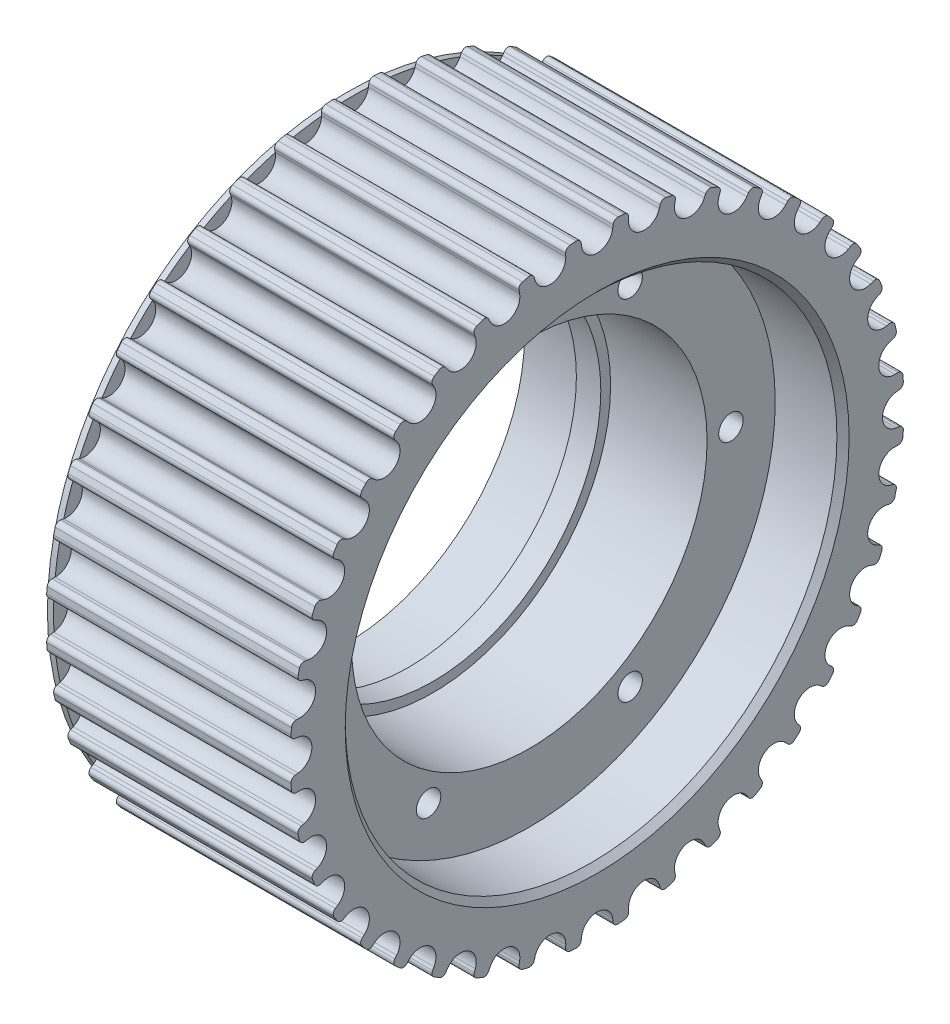
from build123d import *

# Parameters (mm, degrees)
CHAMFER_1_SIZE           = 1
SKETCH_4_W               = 6
SKETCH_4_H               = 2.799999952
CUT_EXTRUDE_1_DEPTH      = 77.373549557
CUT_EXTRUDE_2_REACH      = 78.374
PATTERN_CIRCULAR_3_COUNT = 40
EXTRUDE_1_DEPTH          = 12
SKETCH_8_R               = 24.1
CUT_EXTRUDE_3_DEPTH      = 12
SKETCH_9_R               = 29.1
CUT_EXTRUDE_4_DEPTH      = 82.398102377
SKETCH_10_R              = 40.25
CUT_EXTRUDE_5_DEPTH      = 11.1
SKETCH_11_R              = 2
CUT_EXTRUDE_6_DEPTH      = 77.556260819
CHAMFER_2_SIZE           = 1
SKETCH_12_R              = 49
SKETCH_12_R_2            = 29.1
SKETCH_12_R_3            = 2
EXTRUDE_2_DEPTH          = 1
SKETCH_13_R              = 3.7
CUT_EXTRUDE_7_DEPTH      = 5
EXTRUDE_START            = -4
SKETCH_14_R              = 29.1
SKETCH_14_R_2            = 27.5
EXTRUDE_3_DEPTH          = 4


with BuildPart() as part:
    # 草图1 → 旋转1 (revolve)
    with BuildSketch(Plane.XY):
        Polygon((0, 10.0488), (0, 50.244), (28, 50.244), (28, 20.0976), (20, 20.0976), (20, 10.0488), align=None)
    revolve(axis=Axis((0, 0, 0), (1, 0, 0)))

    # 倒角1
    chamfer_1_edges = [part.edges().sort_by_distance(p)[0] for p in [
        (20, -10.0488, 0),
        (0, -10.0488, 0),
    ]]
    chamfer(chamfer_1_edges, length=CHAMFER_1_SIZE)

    # 草图4 → 切除-拉伸1 (cut, through all)
    with BuildSketch(Plane.ZY):
        with Locations((0, 10.990536011)):
            Rectangle(SKETCH_4_W, SKETCH_4_H)
    extrude(amount=-CUT_EXTRUDE_1_DEPTH, mode=Mode.SUBTRACT)

    # 草图6 → 切除-拉伸2 (cut, up to next)
    with BuildSketch(Plane(origin=(0, 0, 0), x_dir=(0, 0, -1), z_dir=(1, 0, 0)), mode=Mode.PRIVATE) as cut_extrude_2_sk1:
        with BuildLine():
            Line((2.610069182, 49.443149367), (2.55084361, 48.960795787))
            ThreePointArc((2.55084361, 48.960795787), (0, 46.704), (-2.55084361, 48.960795787))
            Line((-2.55084361, 48.960795787), (-2.610069182, 49.443149367))
            ThreePointArc((-2.610069182, 49.443149367), (-2.88771069, 49.949625624), (-3.43762165, 50.126263509))
            ThreePointArc((-3.43762165, 50.126263509), (-3.826604204, 50.098070185), (-4.2153562, 50.066858381))
            Line((-4.2153562, 50.066858381), (-4.412004189, 51.668427723))
            ThreePointArc((-4.412004189, 51.668427723), (0, 51.856457691), (4.412004189, 51.668427723))
            Line((4.412004189, 51.668427723), (4.2153562, 50.066858381))
            ThreePointArc((4.2153562, 50.066858381), (3.826604204, 50.098070185), (3.43762165, 50.126263509))
            ThreePointArc((3.43762165, 50.126263509), (2.88771069, 49.949625624), (2.610069182, 49.443149367))
        make_face()
    cut_extrude_2_tool1 = extrude(cut_extrude_2_sk1.sketch, amount=CUT_EXTRUDE_2_REACH, mode=Mode.PRIVATE) & part.part
    cut_extrude_2 = cut_extrude_2_tool1.solids().sort_by_distance((0, 49.788918, 0))[0]
    add(cut_extrude_2, mode=Mode.SUBTRACT)

    # 阵列(圆周)3: 切除-拉伸2 ×40 about axis
    pattern_circular_3_axis = Axis((-1.4, 0, 0), (1, 0, 0))
    for i in range(1, PATTERN_CIRCULAR_3_COUNT):
        add(cut_extrude_2.rotate(pattern_circular_3_axis, i * 360 / PATTERN_CIRCULAR_3_COUNT), mode=Mode.SUBTRACT)

    # 草图7 → 凸台-拉伸1 (add)
    with BuildSketch(Plane.ZY):
        with BuildLine():
            Line((-5.156677722, 49.242726928), (-5.139717405, 48.757047001))
            ThreePointArc((-5.139717405, 48.757047001), (-7.306115255, 46.128996259), (-10.178594389, 47.95896729))
            Line((-10.178594389, 47.95896729), (-10.31254752, 48.426117376))
            ThreePointArc((-10.31254752, 48.426117376), (-10.666001143, 48.882925369), (-11.236774039, 48.971363522))
            ThreePointArc((-11.236774039, 48.971363522), (-11.729228862, 48.85575428), (-12.220494818, 48.735193058))
            ThreePointArc((-12.220494818, 48.735193058), (-12.688907112, 48.397268615), (-12.796450106, 47.829785125))
            Line((-12.796450106, 47.829785125), (-12.703721519, 47.352737902))
            ThreePointArc((-12.703721519, 47.352737902), (-14.432329705, 44.418143537), (-17.555714394, 45.776229851))
            Line((-17.555714394, 45.776229851), (-17.761096713, 46.216673658))
            ThreePointArc((-17.761096713, 46.216673658), (-18.181659249, 46.612565259), (-18.759239759, 46.610626038))
            ThreePointArc((-18.759239759, 46.610626038), (-19.227546376, 46.419403231), (-19.693904103, 46.223475391))
            ThreePointArc((-19.693904103, 46.223475391), (-20.103686434, 45.816435531), (-20.12113142, 45.239115275))
            Line((-20.12113142, 45.239115275), (-19.954917849, 44.782447241))
            ThreePointArc((-19.954917849, 44.782447241), (-21.2031723, 41.613568706), (-24.500554446, 42.466329711))
            Line((-24.500554446, 42.466329711), (-24.77230876, 42.86922205))
            ThreePointArc((-24.77230876, 42.86922205), (-25.249624564, 43.194449093), (-25.819790738, 43.102180249))
            ThreePointArc((-25.819790738, 43.102180249), (-26.252417886, 42.840052418), (-26.682384108, 42.573582352))
            ThreePointArc((-26.682384108, 42.573582352), (-27.023446277, 42.107449749), (-26.9503637, 41.534508266))
            Line((-26.9503637, 41.534508266), (-26.714757874, 41.109464105))
            ThreePointArc((-26.714757874, 41.109464105), (-27.451922423, 37.784329705), (-30.842109535, 38.110767595))
            Line((-30.842109535, 38.110767595), (-31.17354435, 38.46618792))
            ThreePointArc((-31.17354435, 38.46618792), (-31.695860322, 38.712742236), (-32.244572778, 38.532415735))
            ThreePointArc((-32.244572778, 38.532415735), (-32.63086774, 38.205837336), (-33.013855263, 37.875386423))
            ThreePointArc((-33.013855263, 37.875386423), (-33.277799186, 37.361638808), (-33.115988582, 36.807183819))
            Line((-33.115988582, 36.807183819), (-32.816791899, 36.424229528))
            ThreePointArc((-32.816791899, 36.424229528), (-33.024715109, 33.024715109), (-36.424229528, 32.816791899))
            Line((-36.424229528, 32.816791899), (-36.807183819, 33.115988582))
            ThreePointArc((-36.807183819, 33.115988582), (-37.361638808, 33.277799186), (-37.875386423, 33.013855263))
            ThreePointArc((-37.875386423, 33.013855263), (-38.205837336, 32.63086774), (-38.532415735, 32.244572778))
            ThreePointArc((-38.532415735, 32.244572778), (-38.712742236, 31.695860322), (-38.46618792, 31.17354435))
            Line((-38.46618792, 31.17354435), (-38.110767595, 30.842109535))
            ThreePointArc((-38.110767595, 30.842109535), (-37.784329705, 27.451922423), (-41.109464105, 26.714757874))
            Line((-41.109464105, 26.714757874), (-41.534508266, 26.9503637))
            ThreePointArc((-41.534508266, 26.9503637), (-42.107449749, 27.023446277), (-42.573582352, 26.682384108))
            ThreePointArc((-42.573582352, 26.682384108), (-42.840052418, 26.252417886), (-43.102180249, 25.819790738))
            ThreePointArc((-43.102180249, 25.819790738), (-43.194449093, 25.249624564), (-42.86922205, 24.77230876))
            Line((-42.86922205, 24.77230876), (-42.466329711, 24.500554446))
            ThreePointArc((-42.466329711, 24.500554446), (-41.613568706, 21.2031723), (-44.782447241, 19.954917849))
            Line((-44.782447241, 19.954917849), (-45.239115275, 20.12113142))
            ThreePointArc((-45.239115275, 20.12113142), (-45.816435531, 20.103686434), (-46.223475391, 19.693904103))
            ThreePointArc((-46.223475391, 19.693904103), (-46.419403231, 19.227546376), (-46.610626038, 18.759239759))
            ThreePointArc((-46.610626038, 18.759239759), (-46.612565259, 18.181659249), (-46.216673658, 17.761096713))
            Line((-46.216673658, 17.761096713), (-45.776229851, 17.555714394))
            ThreePointArc((-45.776229851, 17.555714394), (-44.418143537, 14.432329705), (-47.352737902, 12.703721519))
            Line((-47.352737902, 12.703721519), (-47.829785125, 12.796450106))
            ThreePointArc((-47.829785125, 12.796450106), (-48.397268615, 12.688907112), (-48.735193058, 12.220494818))
            ThreePointArc((-48.735193058, 12.220494818), (-48.85575428, 11.729228862), (-48.971363522, 11.236774039))
            ThreePointArc((-48.971363522, 11.236774039), (-48.882925369, 10.666001143), (-48.426117376, 10.31254752))
            Line((-48.426117376, 10.31254752), (-47.95896729, 10.178594389))
            ThreePointArc((-47.95896729, 10.178594389), (-46.128996259, 7.306115255), (-48.757047001, 5.139717405))
            Line((-48.757047001, 5.139717405), (-49.242726928, 5.156677722))
            ThreePointArc((-49.242726928, 5.156677722), (-49.786400323, 4.961684784), (-50.046888529, 4.446176394))
            ThreePointArc((-50.046888529, 4.446176394), (-50.089114516, 3.942098806), (-50.126263509, 3.43762165))
            ThreePointArc((-50.126263509, 3.43762165), (-49.949625624, 2.88771069), (-49.443149367, 2.610069182))
            Line((-49.443149367, 2.610069182), (-48.960795787, 2.55084361))
            ThreePointArc((-48.960795787, 2.55084361), (-46.704, 0), (-48.960795787, -2.55084361))
            Line((-48.960795787, -2.55084361), (-49.443149367, -2.610069182))
            ThreePointArc((-49.443149367, -2.610069182), (-49.949625624, -2.88771069), (-50.126263509, -3.43762165))
            ThreePointArc((-50.126263509, -3.43762165), (-50.089114516, -3.942098806), (-50.046888529, -4.446176394))
            ThreePointArc((-50.046888529, -4.446176394), (-49.786400323, -4.961684784), (-49.242726928, -5.156677722))
            Line((-49.242726928, -5.156677722), (-48.757047001, -5.139717405))
            ThreePointArc((-48.757047001, -5.139717405), (-46.128996259, -7.306115255), (-47.95896729, -10.178594389))
            Line((-47.95896729, -10.178594389), (-48.426117376, -10.31254752))
            ThreePointArc((-48.426117376, -10.31254752), (-48.882925369, -10.666001143), (-48.971363522, -11.236774039))
            ThreePointArc((-48.971363522, -11.236774039), (-48.85575428, -11.729228862), (-48.735193058, -12.220494818))
            ThreePointArc((-48.735193058, -12.220494818), (-48.397268615, -12.688907112), (-47.829785125, -12.796450106))
            Line((-47.829785125, -12.796450106), (-47.352737902, -12.703721519))
            ThreePointArc((-47.352737902, -12.703721519), (-44.418143537, -14.432329705), (-45.776229851, -17.555714394))
            Line((-45.776229851, -17.555714394), (-46.216673658, -17.761096713))
            ThreePointArc((-46.216673658, -17.761096713), (-46.612565259, -18.181659249), (-46.610626038, -18.759239759))
            ThreePointArc((-46.610626038, -18.759239759), (-46.419403231, -19.227546376), (-46.223475391, -19.693904103))
            ThreePointArc((-46.223475391, -19.693904103), (-45.816435531, -20.103686434), (-45.239115275, -20.12113142))
            Line((-45.239115275, -20.12113142), (-44.782447241, -19.954917849))
            ThreePointArc((-44.782447241, -19.954917849), (-41.613568706, -21.2031723), (-42.466329711, -24.500554446))
            Line((-42.466329711, -24.500554446), (-42.86922205, -24.77230876))
            ThreePointArc((-42.86922205, -24.77230876), (-43.194449093, -25.249624564), (-43.102180249, -25.819790738))
            ThreePointArc((-43.102180249, -25.819790738), (-42.840052418, -26.252417886), (-42.573582352, -26.682384108))
            ThreePointArc((-42.573582352, -26.682384108), (-42.107449749, -27.023446277), (-41.534508266, -26.9503637))
            Line((-41.534508266, -26.9503637), (-41.109464105, -26.714757874))
            ThreePointArc((-41.109464105, -26.714757874), (-37.784329705, -27.451922423), (-38.110767595, -30.842109535))
            Line((-38.110767595, -30.842109535), (-38.46618792, -31.17354435))
            ThreePointArc((-38.46618792, -31.17354435), (-38.712742236, -31.695860322), (-38.532415735, -32.244572778))
            ThreePointArc((-38.532415735, -32.244572778), (-38.205837336, -32.63086774), (-37.875386423, -33.013855263))
            ThreePointArc((-37.875386423, -33.013855263), (-37.361638808, -33.277799186), (-36.807183819, -33.115988582))
            Line((-36.807183819, -33.115988582), (-36.424229528, -32.816791899))
            ThreePointArc((-36.424229528, -32.816791899), (-33.024715109, -33.024715109), (-32.816791899, -36.424229528))
            Line((-32.816791899, -36.424229528), (-33.115988582, -36.807183819))
            ThreePointArc((-33.115988582, -36.807183819), (-33.277799186, -37.361638808), (-33.013855263, -37.875386423))
            ThreePointArc((-33.013855263, -37.875386423), (-32.63086774, -38.205837336), (-32.244572778, -38.532415735))
            ThreePointArc((-32.244572778, -38.532415735), (-31.695860322, -38.712742236), (-31.17354435, -38.46618792))
            Line((-31.17354435, -38.46618792), (-30.842109535, -38.110767595))
            ThreePointArc((-30.842109535, -38.110767595), (-27.451922423, -37.784329705), (-26.714757874, -41.109464105))
            Line((-26.714757874, -41.109464105), (-26.9503637, -41.534508266))
            ThreePointArc((-26.9503637, -41.534508266), (-27.023446277, -42.107449749), (-26.682384108, -42.573582352))
            ThreePointArc((-26.682384108, -42.573582352), (-26.252417886, -42.840052418), (-25.819790738, -43.102180249))
            ThreePointArc((-25.819790738, -43.102180249), (-25.249624564, -43.194449093), (-24.77230876, -42.86922205))
            Line((-24.77230876, -42.86922205), (-24.500554446, -42.466329711))
            ThreePointArc((-24.500554446, -42.466329711), (-21.2031723, -41.613568706), (-19.954917849, -44.782447241))
            Line((-19.954917849, -44.782447241), (-20.12113142, -45.239115275))
            ThreePointArc((-20.12113142, -45.239115275), (-20.103686434, -45.816435531), (-19.693904103, -46.223475391))
            ThreePointArc((-19.693904103, -46.223475391), (-19.227546376, -46.419403231), (-18.759239759, -46.610626038))
            ThreePointArc((-18.759239759, -46.610626038), (-18.181659249, -46.612565259), (-17.761096713, -46.216673658))
            Line((-17.761096713, -46.216673658), (-17.555714394, -45.776229851))
            ThreePointArc((-17.555714394, -45.776229851), (-14.432329705, -44.418143537), (-12.703721519, -47.352737902))
            Line((-12.703721519, -47.352737902), (-12.796450106, -47.829785125))
            ThreePointArc((-12.796450106, -47.829785125), (-12.688907112, -48.397268615), (-12.220494818, -48.735193058))
            ThreePointArc((-12.220494818, -48.735193058), (-11.729228862, -48.85575428), (-11.236774039, -48.971363522))
            ThreePointArc((-11.236774039, -48.971363522), (-10.666001143, -48.882925369), (-10.31254752, -48.426117376))
            Line((-10.31254752, -48.426117376), (-10.178594389, -47.95896729))
            ThreePointArc((-10.178594389, -47.95896729), (-7.306115255, -46.128996259), (-5.139717405, -48.757047001))
            Line((-5.139717405, -48.757047001), (-5.156677722, -49.242726928))
            ThreePointArc((-5.156677722, -49.242726928), (-4.961684784, -49.786400323), (-4.446176394, -50.046888529))
            ThreePointArc((-4.446176394, -50.046888529), (-3.942098806, -50.089114516), (-3.43762165, -50.126263509))
            ThreePointArc((-3.43762165, -50.126263509), (-2.88771069, -49.949625624), (-2.610069182, -49.443149367))
            Line((-2.610069182, -49.443149367), (-2.55084361, -48.960795787))
            ThreePointArc((-2.55084361, -48.960795787), (0, -46.704), (2.55084361, -48.960795787))
            Line((2.55084361, -48.960795787), (2.610069182, -49.443149367))
            ThreePointArc((2.610069182, -49.443149367), (2.88771069, -49.949625624), (3.43762165, -50.126263509))
            ThreePointArc((3.43762165, -50.126263509), (3.942098806, -50.089114516), (4.446176394, -50.046888529))
            ThreePointArc((4.446176394, -50.046888529), (4.961684784, -49.786400323), (5.156677722, -49.242726928))
            Line((5.156677722, -49.242726928), (5.139717405, -48.757047001))
            ThreePointArc((5.139717405, -48.757047001), (7.306115255, -46.128996259), (10.178594389, -47.95896729))
            Line((10.178594389, -47.95896729), (10.31254752, -48.426117376))
            ThreePointArc((10.31254752, -48.426117376), (10.666001143, -48.882925369), (11.236774039, -48.971363522))
            ThreePointArc((11.236774039, -48.971363522), (11.729228862, -48.85575428), (12.220494818, -48.735193058))
            ThreePointArc((12.220494818, -48.735193058), (12.688907112, -48.397268615), (12.796450106, -47.829785125))
            Line((12.796450106, -47.829785125), (12.703721519, -47.352737902))
            ThreePointArc((12.703721519, -47.352737902), (14.432329705, -44.418143537), (17.555714394, -45.776229851))
            Line((17.555714394, -45.776229851), (17.761096713, -46.216673658))
            ThreePointArc((17.761096713, -46.216673658), (18.181659249, -46.612565259), (18.759239759, -46.610626038))
            ThreePointArc((18.759239759, -46.610626038), (19.227546376, -46.419403231), (19.693904103, -46.223475391))
            ThreePointArc((19.693904103, -46.223475391), (20.103686434, -45.816435531), (20.12113142, -45.239115275))
            Line((20.12113142, -45.239115275), (19.954917849, -44.782447241))
            ThreePointArc((19.954917849, -44.782447241), (21.2031723, -41.613568706), (24.500554446, -42.466329711))
            Line((24.500554446, -42.466329711), (24.77230876, -42.86922205))
            ThreePointArc((24.77230876, -42.86922205), (25.249624564, -43.194449093), (25.819790738, -43.102180249))
            ThreePointArc((25.819790738, -43.102180249), (26.252417886, -42.840052418), (26.682384108, -42.573582352))
            ThreePointArc((26.682384108, -42.573582352), (27.023446277, -42.107449749), (26.9503637, -41.534508266))
            Line((26.9503637, -41.534508266), (26.714757874, -41.109464105))
            ThreePointArc((26.714757874, -41.109464105), (27.451922423, -37.784329705), (30.842109535, -38.110767595))
            Line((30.842109535, -38.110767595), (31.17354435, -38.46618792))
            ThreePointArc((31.17354435, -38.46618792), (31.695860322, -38.712742236), (32.244572778, -38.532415735))
            ThreePointArc((32.244572778, -38.532415735), (32.63086774, -38.205837336), (33.013855263, -37.875386423))
            ThreePointArc((33.013855263, -37.875386423), (33.277799186, -37.361638808), (33.115988582, -36.807183819))
            Line((33.115988582, -36.807183819), (32.816791899, -36.424229528))
            ThreePointArc((32.816791899, -36.424229528), (33.024715109, -33.024715109), (36.424229528, -32.816791899))
            Line((36.424229528, -32.816791899), (36.807183819, -33.115988582))
            ThreePointArc((36.807183819, -33.115988582), (37.361638808, -33.277799186), (37.875386423, -33.013855263))
            ThreePointArc((37.875386423, -33.013855263), (38.205837336, -32.63086774), (38.532415735, -32.244572778))
            ThreePointArc((38.532415735, -32.244572778), (38.712742236, -31.695860322), (38.46618792, -31.17354435))
            Line((38.46618792, -31.17354435), (38.110767595, -30.842109535))
            ThreePointArc((38.110767595, -30.842109535), (37.784329705, -27.451922423), (41.109464105, -26.714757874))
            Line((41.109464105, -26.714757874), (41.534508266, -26.9503637))
            ThreePointArc((41.534508266, -26.9503637), (42.107449749, -27.023446277), (42.573582352, -26.682384108))
            ThreePointArc((42.573582352, -26.682384108), (42.840052418, -26.252417886), (43.102180249, -25.819790738))
            ThreePointArc((43.102180249, -25.819790738), (43.194449093, -25.249624564), (42.86922205, -24.77230876))
            Line((42.86922205, -24.77230876), (42.466329711, -24.500554446))
            ThreePointArc((42.466329711, -24.500554446), (41.613568706, -21.2031723), (44.782447241, -19.954917849))
            Line((44.782447241, -19.954917849), (45.239115275, -20.12113142))
            ThreePointArc((45.239115275, -20.12113142), (45.816435531, -20.103686434), (46.223475391, -19.693904103))
            ThreePointArc((46.223475391, -19.693904103), (46.419403231, -19.227546376), (46.610626038, -18.759239759))
            ThreePointArc((46.610626038, -18.759239759), (46.612565259, -18.181659249), (46.216673658, -17.761096713))
            Line((46.216673658, -17.761096713), (45.776229851, -17.555714394))
            ThreePointArc((45.776229851, -17.555714394), (44.418143537, -14.432329705), (47.352737902, -12.703721519))
            Line((47.352737902, -12.703721519), (47.829785125, -12.796450106))
            ThreePointArc((47.829785125, -12.796450106), (48.397268615, -12.688907112), (48.735193058, -12.220494818))
            ThreePointArc((48.735193058, -12.220494818), (48.85575428, -11.729228862), (48.971363522, -11.236774039))
            ThreePointArc((48.971363522, -11.236774039), (48.882925369, -10.666001143), (48.426117376, -10.31254752))
            Line((48.426117376, -10.31254752), (47.95896729, -10.178594389))
            ThreePointArc((47.95896729, -10.178594389), (46.128996259, -7.306115255), (48.757047001, -5.139717405))
            Line((48.757047001, -5.139717405), (49.242726928, -5.156677722))
            ThreePointArc((49.242726928, -5.156677722), (49.786400323, -4.961684784), (50.046888529, -4.446176394))
            ThreePointArc((50.046888529, -4.446176394), (50.089114516, -3.942098806), (50.126263509, -3.43762165))
            ThreePointArc((50.126263509, -3.43762165), (49.949625624, -2.88771069), (49.443149367, -2.610069182))
            Line((49.443149367, -2.610069182), (48.960795787, -2.55084361))
            ThreePointArc((48.960795787, -2.55084361), (46.704, 0), (48.960795787, 2.55084361))
            Line((48.960795787, 2.55084361), (49.443149367, 2.610069182))
            ThreePointArc((49.443149367, 2.610069182), (49.949625624, 2.88771069), (50.126263509, 3.43762165))
            ThreePointArc((50.126263509, 3.43762165), (50.089114516, 3.942098806), (50.046888529, 4.446176394))
            ThreePointArc((50.046888529, 4.446176394), (49.786400323, 4.961684784), (49.242726928, 5.156677722))
            Line((49.242726928, 5.156677722), (48.757047001, 5.139717405))
            ThreePointArc((48.757047001, 5.139717405), (46.128996259, 7.306115255), (47.95896729, 10.178594389))
            Line((47.95896729, 10.178594389), (48.426117376, 10.31254752))
            ThreePointArc((48.426117376, 10.31254752), (48.882925369, 10.666001143), (48.971363522, 11.236774039))
            ThreePointArc((48.971363522, 11.236774039), (48.85575428, 11.729228862), (48.735193058, 12.220494818))
            ThreePointArc((48.735193058, 12.220494818), (48.397268615, 12.688907112), (47.829785125, 12.796450106))
            Line((47.829785125, 12.796450106), (47.352737902, 12.703721519))
            ThreePointArc((47.352737902, 12.703721519), (44.418143537, 14.432329705), (45.776229851, 17.555714394))
            Line((45.776229851, 17.555714394), (46.216673658, 17.761096713))
            ThreePointArc((46.216673658, 17.761096713), (46.612565259, 18.181659249), (46.610626038, 18.759239759))
            ThreePointArc((46.610626038, 18.759239759), (46.419403231, 19.227546376), (46.223475391, 19.693904103))
            ThreePointArc((46.223475391, 19.693904103), (45.816435531, 20.103686434), (45.239115275, 20.12113142))
            Line((45.239115275, 20.12113142), (44.782447241, 19.954917849))
            ThreePointArc((44.782447241, 19.954917849), (41.613568706, 21.2031723), (42.466329711, 24.500554446))
            Line((42.466329711, 24.500554446), (42.86922205, 24.77230876))
            ThreePointArc((42.86922205, 24.77230876), (43.194449093, 25.249624564), (43.102180249, 25.819790738))
            ThreePointArc((43.102180249, 25.819790738), (42.840052418, 26.252417886), (42.573582352, 26.682384108))
            ThreePointArc((42.573582352, 26.682384108), (42.107449749, 27.023446277), (41.534508266, 26.9503637))
            Line((41.534508266, 26.9503637), (41.109464105, 26.714757874))
            ThreePointArc((41.109464105, 26.714757874), (37.784329705, 27.451922423), (38.110767595, 30.842109535))
            Line((38.110767595, 30.842109535), (38.46618792, 31.17354435))
            ThreePointArc((38.46618792, 31.17354435), (38.712742236, 31.695860322), (38.532415735, 32.244572778))
            ThreePointArc((38.532415735, 32.244572778), (38.205837336, 32.63086774), (37.875386423, 33.013855263))
            ThreePointArc((37.875386423, 33.013855263), (37.361638808, 33.277799186), (36.807183819, 33.115988582))
            Line((36.807183819, 33.115988582), (36.424229528, 32.816791899))
            ThreePointArc((36.424229528, 32.816791899), (33.024715109, 33.024715109), (32.816791899, 36.424229528))
            Line((32.816791899, 36.424229528), (33.115988582, 36.807183819))
            ThreePointArc((33.115988582, 36.807183819), (33.277799186, 37.361638808), (33.013855263, 37.875386423))
            ThreePointArc((33.013855263, 37.875386423), (32.63086774, 38.205837336), (32.244572778, 38.532415735))
            ThreePointArc((32.244572778, 38.532415735), (31.695860322, 38.712742236), (31.17354435, 38.46618792))
            Line((31.17354435, 38.46618792), (30.842109535, 38.110767595))
            ThreePointArc((30.842109535, 38.110767595), (27.451922423, 37.784329705), (26.714757874, 41.109464105))
            Line((26.714757874, 41.109464105), (26.9503637, 41.534508266))
            ThreePointArc((26.9503637, 41.534508266), (27.023446277, 42.107449749), (26.682384108, 42.573582352))
            ThreePointArc((26.682384108, 42.573582352), (26.252417886, 42.840052418), (25.819790738, 43.102180249))
            ThreePointArc((25.819790738, 43.102180249), (25.249624564, 43.194449093), (24.77230876, 42.86922205))
            Line((24.77230876, 42.86922205), (24.500554446, 42.466329711))
            ThreePointArc((24.500554446, 42.466329711), (21.2031723, 41.613568706), (19.954917849, 44.782447241))
            Line((19.954917849, 44.782447241), (20.12113142, 45.239115275))
            ThreePointArc((20.12113142, 45.239115275), (20.103686434, 45.816435531), (19.693904103, 46.223475391))
            ThreePointArc((19.693904103, 46.223475391), (19.227546376, 46.419403231), (18.759239759, 46.610626038))
            ThreePointArc((18.759239759, 46.610626038), (18.181659249, 46.612565259), (17.761096713, 46.216673658))
            Line((17.761096713, 46.216673658), (17.555714394, 45.776229851))
            ThreePointArc((17.555714394, 45.776229851), (14.432329705, 44.418143537), (12.703721519, 47.352737902))
            Line((12.703721519, 47.352737902), (12.796450106, 47.829785125))
            ThreePointArc((12.796450106, 47.829785125), (12.688907112, 48.397268615), (12.220494818, 48.735193058))
            ThreePointArc((12.220494818, 48.735193058), (11.729228862, 48.85575428), (11.236774039, 48.971363522))
            ThreePointArc((11.236774039, 48.971363522), (10.666001143, 48.882925369), (10.31254752, 48.426117376))
            Line((10.31254752, 48.426117376), (10.178594389, 47.95896729))
            ThreePointArc((10.178594389, 47.95896729), (7.306115255, 46.128996259), (5.139717405, 48.757047001))
            Line((5.139717405, 48.757047001), (5.156677722, 49.242726928))
            ThreePointArc((5.156677722, 49.242726928), (4.961684784, 49.786400323), (4.446176394, 50.046888529))
            ThreePointArc((4.446176394, 50.046888529), (3.942098806, 50.089114516), (3.43762165, 50.126263509))
            ThreePointArc((3.43762165, 50.126263509), (2.88771069, 49.949625624), (2.610069182, 49.443149367))
            Line((2.610069182, 49.443149367), (2.55084361, 48.960795787))
            ThreePointArc((2.55084361, 48.960795787), (0, 46.704), (-2.55084361, 48.960795787))
            Line((-2.55084361, 48.960795787), (-2.610069182, 49.443149367))
            ThreePointArc((-2.610069182, 49.443149367), (-2.88771069, 49.949625624), (-3.43762165, 50.126263509))
            ThreePointArc((-3.43762165, 50.126263509), (-3.942098806, 50.089114516), (-4.446176394, 50.046888529))
            ThreePointArc((-4.446176394, 50.046888529), (-4.961684784, 49.786400323), (-5.156677722, 49.242726928))
        make_face()
    extrude(amount=EXTRUDE_1_DEPTH)

    # 草图8 → 切除-拉伸3 (cut)
    with BuildSketch(Plane(origin=(28, 0, 0), x_dir=(0, 0, -1), z_dir=(1, 0, 0))):
        Circle(SKETCH_8_R)
    extrude(amount=-CUT_EXTRUDE_3_DEPTH, mode=Mode.SUBTRACT)

    # 草图9 → 切除-拉伸4 (cut, through all)
    with BuildSketch(Plane(origin=(28, 0, 0), x_dir=(0, 0, -1), z_dir=(1, 0, 0))):
        Circle(SKETCH_9_R)
    extrude(amount=-CUT_EXTRUDE_4_DEPTH, mode=Mode.SUBTRACT)

    # 草图10 → 切除-拉伸5 (cut)
    with BuildSketch(Plane(origin=(28, 0, 0), x_dir=(0, 0, -1), z_dir=(1, 0, 0))):
        Circle(SKETCH_10_R)
    extrude(amount=-CUT_EXTRUDE_5_DEPTH, mode=Mode.SUBTRACT)

    # 草图11 → 切除-拉伸6 (cut, through all)
    with BuildSketch(Plane(origin=(16.9, 0, 0), x_dir=(0, 0, -1), z_dir=(1, 0, 0))):
        with Locations((33, 0)):
            Circle(SKETCH_11_R)
        with Locations((16.5, -28.578838325)):
            Circle(SKETCH_11_R)
        with Locations((-16.5, -28.578838325)):
            Circle(SKETCH_11_R)
        with Locations((-33, 0)):
            Circle(SKETCH_11_R)
        with Locations((-16.5, 28.578838325)):
            Circle(SKETCH_11_R)
        with Locations((16.5, 28.578838325)):
            Circle(SKETCH_11_R)
    extrude(amount=-CUT_EXTRUDE_6_DEPTH, mode=Mode.SUBTRACT)

    # 倒角2
    chamfer_2_edges = [part.edges().sort_by_distance(p)[0] for p in [
        (28, 0, 40.25),
    ]]
    chamfer(chamfer_2_edges, length=CHAMFER_2_SIZE)

    # 草图12 → 凸台-拉伸2 (add)
    with BuildSketch(Plane.ZY.offset(12)):
        Circle(SKETCH_12_R)
        Circle(SKETCH_12_R_2, mode=Mode.SUBTRACT)
        with Locations((16.5, 28.578838325)):
            Circle(SKETCH_12_R_3, mode=Mode.SUBTRACT)
        with Locations((-16.5, 28.578838325)):
            Circle(SKETCH_12_R_3, mode=Mode.SUBTRACT)
        with Locations((-33, 0)):
            Circle(SKETCH_12_R_3, mode=Mode.SUBTRACT)
        with Locations((-16.5, -28.578838325)):
            Circle(SKETCH_12_R_3, mode=Mode.SUBTRACT)
        with Locations((16.5, -28.578838325)):
            Circle(SKETCH_12_R_3, mode=Mode.SUBTRACT)
        with Locations((33, 0)):
            Circle(SKETCH_12_R_3, mode=Mode.SUBTRACT)
    extrude(amount=EXTRUDE_2_DEPTH)

    # 草图13 → 切除-拉伸7 (cut)
    with BuildSketch(Plane.ZY.offset(13)):
        with Locations((16.5, 28.578838325)):
            Circle(SKETCH_13_R)
        with Locations((33, 0)):
            Circle(SKETCH_13_R)
        with Locations((16.5, -28.578838325)):
            Circle(SKETCH_13_R)
        with Locations((-16.5, -28.578838325)):
            Circle(SKETCH_13_R)
        with Locations((-33, 0)):
            Circle(SKETCH_13_R)
        with Locations((-16.5, 28.578838325)):
            Circle(SKETCH_13_R)
    extrude(amount=-CUT_EXTRUDE_7_DEPTH, mode=Mode.SUBTRACT)

    # 草图14 → 凸台-拉伸3 (add)
    with BuildSketch(Plane.ZY.offset(2.9).offset(EXTRUDE_START)):
        Circle(SKETCH_14_R)
        Circle(SKETCH_14_R_2, mode=Mode.SUBTRACT)
    extrude(amount=EXTRUDE_3_DEPTH)


solid = part.part
